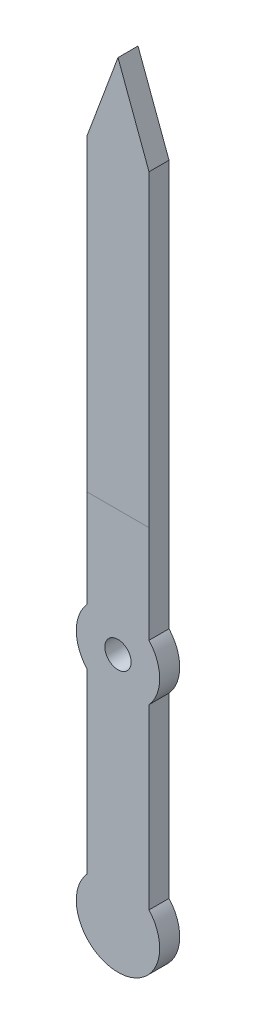
from build123d import *

# Parameters (mm, degrees)
SKETCH1_R           = 0.5
BOSS_EXTRUDE1_DEPTH = 0.762


with BuildPart() as part:
    # Sketch1 → Boss-Extrude1 (new body)
    with BuildSketch(Plane.XY):
        with BuildLine():
            Line((-1.1811, -1.060735141), (-1.1811, -7.829264859))
            ThreePointArc((-1.1811, -7.829264859), (0, -10.4775), (1.1811, -7.829264859))
            Line((1.1811, -7.829264859), (1.1811, -1.060735141))
            ThreePointArc((1.1811, -1.060735141), (1.5875, 0), (1.1811, 1.060735141))
            Line((1.1811, 1.060735141), (1.1811, 16.51))
            Line((1.1811, 16.51), (0, 19.685))
            Line((0, 19.685), (-1.1811, 16.51))
            Line((-1.1811, 16.51), (-1.1811, 1.060735141))
            ThreePointArc((-1.1811, 1.060735141), (-1.5875, 0), (-1.1811, -1.060735141))
        make_face()
        Circle(SKETCH1_R, mode=Mode.SUBTRACT)
    extrude(amount=BOSS_EXTRUDE1_DEPTH)


solid = part.part
